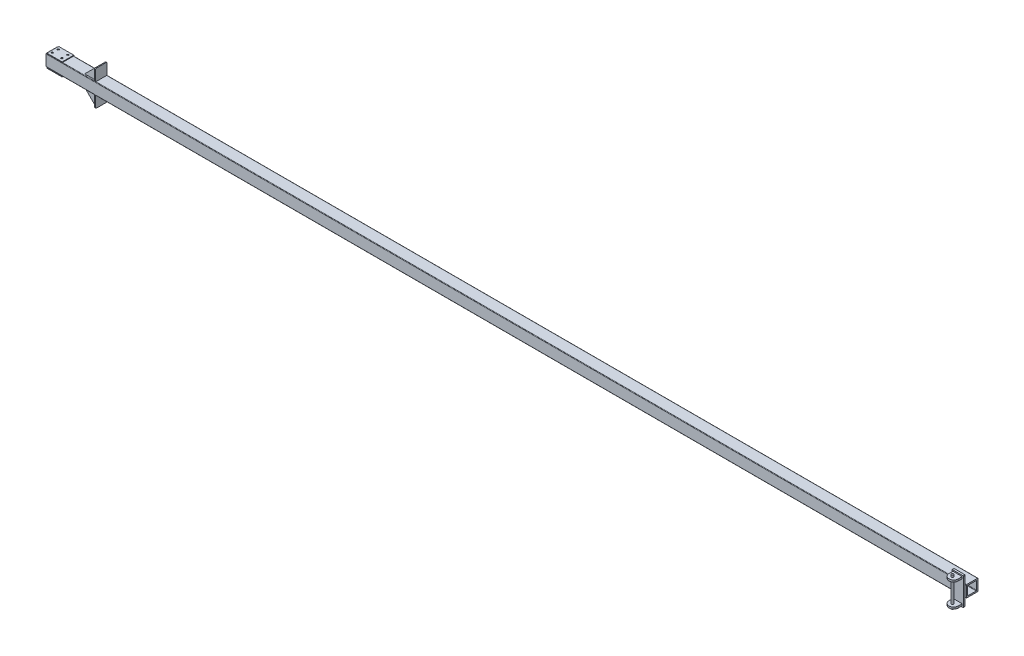
from build123d import *

# Parameters (mm, degrees)
BOSS_EXTRUDE2_START         = -23.4
BOSS_EXTRUDE2_OUTLINE_W     = 4000
BOSS_EXTRUDE2_OUTLINE_H     = 5.9182
BOSS_EXTRUDE2_DEPTH         = 46.8
BOSS_EXTRUDE2_START_2       = -25.4
BOSS_EXTRUDE2_2_OUTLINE_W   = 50
BOSS_EXTRUDE2_2_OUTLINE_H   = 8
BOSS_EXTRUDE2_2_OUTLINE_W_2 = 4000
BOSS_EXTRUDE2_2_OUTLINE_H_2 = 38.9636
BOSS_EXTRUDE2_2_DEPTH       = 5.9182
BOSS_EXTRUDE2_START_3       = 19.4818
BOSS_EXTRUDE2_3_OUTLINE_W   = 50
BOSS_EXTRUDE2_3_OUTLINE_H   = 8
BOSS_EXTRUDE2_3_OUTLINE_W_2 = 4000
BOSS_EXTRUDE2_3_OUTLINE_H_2 = 38.9636
BOSS_EXTRUDE2_3_DEPTH       = 5.9182
BOSS_EXTRUDE2_START_4       = -60
BOSS_EXTRUDE2_4_OUTLINE_W   = 50
BOSS_EXTRUDE2_4_OUTLINE_H   = 8
BOSS_EXTRUDE2_4_DEPTH       = 120
BOSS_EXTRUDE2_START_5       = -28.4
BOSS_EXTRUDE2_5_OUTLINE_W   = 65
BOSS_EXTRUDE2_5_OUTLINE_H   = 50.8
BOSS_EXTRUDE2_5_OUTLINE_R   = 4
BOSS_EXTRUDE2_5_DEPTH       = 3
BOSS_EXTRUDE2_START_6       = 25.4
BOSS_EXTRUDE2_6_OUTLINE_W   = 65
BOSS_EXTRUDE2_6_OUTLINE_H   = 50.8
BOSS_EXTRUDE2_6_OUTLINE_R   = 4
BOSS_EXTRUDE2_6_DEPTH       = 3
BOSS_EXTRUDE2_START_7       = -4000
BOSS_EXTRUDE2_7_DEPTH       = 4000
SKETCH1_W                   = 40
SKETCH1_H                   = 8
BOSS_EXTRUDE1_DEPTH         = 45
FILLET1_R                   = 20
FILLET2_R                   = 2
BOSS_EXTRUDE3_DEPTH         = 10
BOSS_EXTRUDE3_DEPTH_BACK    = 120
SKETCH3_R                   = 4
SKETCH4_W                   = 4
SKETCH4_H                   = 150.8
BOSS_EXTRUDE4_DEPTH         = 50.8
SKETCH5_W                   = 5
SKETCH5_H                   = 50
BOSS_EXTRUDE5_DEPTH         = 50
CUT_EXTRUDE4_DEPTH          = 4002.695965463
FILLET3_R                   = 5
FILLET4_R                   = 5
FILLET5_R                   = 5
FILLET6_R                   = 5


with BuildPart() as part:
    # Boss-Extrude2: read off the stored shape, not the designer's step
    # Boss-Extrude2 outline → Boss-Extrude2 (new body)
    with BuildSketch(Plane(origin=(0, 0, 0), x_dir=(1, 0, 0), z_dir=(0, 1, 0)).offset(BOSS_EXTRUDE2_START)):
        Polygon((-55, -25.4), (-55, -33.4), (-5, -33.4), (-5, -25.4), (0, -25.4), (0, -19.4818), (-4000, -19.4818), (-4000, -25.4), align=None)
        with Locations((-2000, 22.4409)):
            Rectangle(BOSS_EXTRUDE2_OUTLINE_W, BOSS_EXTRUDE2_OUTLINE_H)
    extrude(amount=BOSS_EXTRUDE2_DEPTH)

    # Boss-Extrude2 2 outline → Boss-Extrude2 2 (add)
    with BuildSketch(Plane(origin=(0, 0, 0), x_dir=(1, 0, 0), z_dir=(0, 1, 0)).offset(BOSS_EXTRUDE2_START_2)):
        with Locations((-30, -29.4)):
            Rectangle(BOSS_EXTRUDE2_2_OUTLINE_W, BOSS_EXTRUDE2_2_OUTLINE_H)
        with Locations((-2000, 0)):
            Rectangle(BOSS_EXTRUDE2_2_OUTLINE_W_2, BOSS_EXTRUDE2_2_OUTLINE_H_2)
    extrude(amount=BOSS_EXTRUDE2_2_DEPTH)

    # Boss-Extrude2 3 outline → Boss-Extrude2 3 (add)
    with BuildSketch(Plane(origin=(0, 0, 0), x_dir=(1, 0, 0), z_dir=(0, 1, 0)).offset(BOSS_EXTRUDE2_START_3)):
        with Locations((-30, -29.4)):
            Rectangle(BOSS_EXTRUDE2_3_OUTLINE_W, BOSS_EXTRUDE2_3_OUTLINE_H)
        with Locations((-2000, 0)):
            Rectangle(BOSS_EXTRUDE2_3_OUTLINE_W_2, BOSS_EXTRUDE2_3_OUTLINE_H_2)
    extrude(amount=BOSS_EXTRUDE2_3_DEPTH)

    # Boss-Extrude2 4 outline → Boss-Extrude2 4 (add)
    with BuildSketch(Plane(origin=(0, 0, 0), x_dir=(1, 0, 0), z_dir=(0, 1, 0)).offset(BOSS_EXTRUDE2_START_4)):
        with Locations((-30, -29.4)):
            Rectangle(BOSS_EXTRUDE2_4_OUTLINE_W, BOSS_EXTRUDE2_4_OUTLINE_H)
    extrude(amount=BOSS_EXTRUDE2_4_DEPTH)

    # Boss-Extrude2 5 outline → Boss-Extrude2 5 (add)
    with BuildSketch(Plane(origin=(0, 0, 0), x_dir=(1, 0, 0), z_dir=(0, 1, 0)).offset(BOSS_EXTRUDE2_START_5)):
        with Locations((-3962.5, 0)):
            Rectangle(BOSS_EXTRUDE2_5_OUTLINE_W, BOSS_EXTRUDE2_5_OUTLINE_H)
        with Locations((-3944, 12.4)):
            Circle(BOSS_EXTRUDE2_5_OUTLINE_R, mode=Mode.SUBTRACT)
        with Locations((-3985, -12.4)):
            Circle(BOSS_EXTRUDE2_5_OUTLINE_R, mode=Mode.SUBTRACT)
        with Locations((-3944, -12.4)):
            Circle(BOSS_EXTRUDE2_5_OUTLINE_R, mode=Mode.SUBTRACT)
        with Locations((-3985, 12.4)):
            Circle(BOSS_EXTRUDE2_5_OUTLINE_R, mode=Mode.SUBTRACT)
    extrude(amount=BOSS_EXTRUDE2_5_DEPTH)

    # Boss-Extrude2 6 outline → Boss-Extrude2 6 (add)
    with BuildSketch(Plane(origin=(0, 0, 0), x_dir=(1, 0, 0), z_dir=(0, 1, 0)).offset(BOSS_EXTRUDE2_START_6)):
        with Locations((-3962.5, 0)):
            Rectangle(BOSS_EXTRUDE2_6_OUTLINE_W, BOSS_EXTRUDE2_6_OUTLINE_H)
        with Locations((-3944, 12.4)):
            Circle(BOSS_EXTRUDE2_6_OUTLINE_R, mode=Mode.SUBTRACT)
        with Locations((-3985, -12.4)):
            Circle(BOSS_EXTRUDE2_6_OUTLINE_R, mode=Mode.SUBTRACT)
        with Locations((-3944, -12.4)):
            Circle(BOSS_EXTRUDE2_6_OUTLINE_R, mode=Mode.SUBTRACT)
        with Locations((-3985, 12.4)):
            Circle(BOSS_EXTRUDE2_6_OUTLINE_R, mode=Mode.SUBTRACT)
    extrude(amount=BOSS_EXTRUDE2_6_DEPTH)

    # Boss-Extrude2 7 outline → Boss-Extrude2 7 (add)
    with BuildSketch(Plane.YZ.offset(BOSS_EXTRUDE2_START_7)):
        with BuildLine():
            Line((23.4, 19.4818), (25.4, 19.4818))
            Line((25.4, 19.4818), (25.4, 23.4))
            ThreePointArc((25.4, 23.4), (24.814213562, 24.814213562), (23.4, 25.4))
            Line((23.4, 25.4), (23.4, 19.4818))
        make_face()
        with BuildLine():
            ThreePointArc((23.4, -25.4), (24.814213562, -24.814213562), (25.4, -23.4))
            Line((25.4, -23.4), (25.4, -19.4818))
            Line((25.4, -19.4818), (23.4, -19.4818))
            Line((23.4, -19.4818), (23.4, -25.4))
        make_face()
        with BuildLine():
            Line((19.4818, 19.4818), (17.4818, 19.4818))
            ThreePointArc((17.4818, 19.4818), (18.896013562, 18.896013562), (19.4818, 17.4818))
            Line((19.4818, 17.4818), (19.4818, 19.4818))
        make_face()
        with BuildLine():
            ThreePointArc((-19.4818, 17.4818), (-18.896013562, 18.896013562), (-17.4818, 19.4818))
            Line((-17.4818, 19.4818), (-19.4818, 19.4818))
            Line((-19.4818, 19.4818), (-19.4818, 17.4818))
        make_face()
        with BuildLine():
            Line((19.4818, -19.4818), (19.4818, -17.4818))
            ThreePointArc((19.4818, -17.4818), (18.896013562, -18.896013562), (17.4818, -19.4818))
            Line((17.4818, -19.4818), (19.4818, -19.4818))
        make_face()
        with BuildLine():
            ThreePointArc((-17.4818, -19.4818), (-18.896013562, -18.896013562), (-19.4818, -17.4818))
            Line((-19.4818, -17.4818), (-19.4818, -19.4818))
            Line((-19.4818, -19.4818), (-17.4818, -19.4818))
        make_face()
        with BuildLine():
            Line((-25.4, 23.4), (-25.4, 19.4818))
            Line((-25.4, 19.4818), (-23.4, 19.4818))
            Line((-23.4, 19.4818), (-23.4, 25.4))
            ThreePointArc((-23.4, 25.4), (-24.814213562, 24.814213562), (-25.4, 23.4))
        make_face()
        with BuildLine():
            ThreePointArc((-25.4, -23.4), (-24.814213562, -24.814213562), (-23.4, -25.4))
            Line((-23.4, -25.4), (-23.4, -19.4818))
            Line((-23.4, -19.4818), (-25.4, -19.4818))
            Line((-25.4, -19.4818), (-25.4, -23.4))
        make_face()
    extrude(amount=BOSS_EXTRUDE2_7_DEPTH)

    # Sketch1 → Boss-Extrude1 (add)
    with BuildSketch(Plane.XY.offset(25.4)):
        with Locations((-30, 51)):
            Rectangle(SKETCH1_W, SKETCH1_H)
        with Locations((-30, -51)):
            Rectangle(SKETCH1_W, SKETCH1_H)
    extrude(amount=BOSS_EXTRUDE1_DEPTH)

    # Fillet1
    fillet1_edges = [part.edges().sort_by_distance(p)[0] for p in [
        (-10, 51, 70.4),
        (-50, 51, 70.4),
        (-50, -51, 70.4),
        (-10, -51, 70.4),
    ]]
    fillet(fillet1_edges, radius=FILLET1_R - 0.0001)  # a hair under: the kernel refuses the full size

    # Fillet2
    fillet2_edges = [part.edges().sort_by_distance(p)[0] for p in [
        (-5, -60, 29.4),
        (-5, 60, 29.4),
        (-55, 60, 29.4),
        (-55, -60, 29.4),
    ]]
    fillet(fillet2_edges, radius=FILLET2_R)

    # Sketch3 → Boss-Extrude3 (add, two sides: drawn at the far end of the back side and taken through both)
    with BuildSketch(Plane.XZ.offset(55).offset(-BOSS_EXTRUDE3_DEPTH_BACK)):
        with Locations((-30, 55.4)):
            Circle(SKETCH3_R)
    extrude(amount=BOSS_EXTRUDE3_DEPTH + BOSS_EXTRUDE3_DEPTH_BACK)

    # Sketch4 → Boss-Extrude4 (add)
    with BuildSketch(Plane.XY.offset(25.4)):
        with Locations((-3786.973621807, 0)):
            Rectangle(SKETCH4_W, SKETCH4_H)
    extrude(amount=-BOSS_EXTRUDE4_DEPTH)

    # Sketch5 → Boss-Extrude5 (add)
    with BuildSketch(Plane.ZY.offset(3788.973621807)):
        with Locations((15.9, 50.4)):
            Rectangle(SKETCH5_W, SKETCH5_H)
        with Locations((15.9, -50.4)):
            Rectangle(SKETCH5_W, SKETCH5_H)
        with Locations((-15.9, -50.4)):
            Rectangle(SKETCH5_W, SKETCH5_H)
        with Locations((-15.9, 50.4)):
            Rectangle(SKETCH5_W, SKETCH5_H)
    extrude(amount=BOSS_EXTRUDE5_DEPTH)

    # Sketch6 → Cut-Extrude4 (cut, through all)
    with BuildSketch(Plane(origin=(0, 0, -18.4), x_dir=(-1, 0, 0), z_dir=(0, 0, -1))):
        Polygon((3788.973621807, 75.4), (3838.973621807, 25.4), (3838.973621807, 75.4), align=None)
        Polygon((3788.973621807, -75.4), (3838.973621807, -25.4), (3838.973621807, -75.4), align=None)
    extrude(amount=-CUT_EXTRUDE4_DEPTH, mode=Mode.SUBTRACT)

    # Fillet3
    fillet3_edges = [part.edges().sort_by_distance(p)[0] for p in [
        (-3786.973621807, 75.4, -25.4),
    ]]
    fillet(fillet3_edges, radius=FILLET3_R)

    # Fillet4
    fillet4_edges = [part.edges().sort_by_distance(p)[0] for p in [
        (-3786.973621807, 75.4, 25.4),
    ]]
    fillet(fillet4_edges, radius=FILLET4_R)

    # Fillet5
    fillet5_edges = [part.edges().sort_by_distance(p)[0] for p in [
        (-3786.973621807, -75.4, 25.4),
    ]]
    fillet(fillet5_edges, radius=FILLET5_R)

    # Fillet6
    fillet6_edges = [part.edges().sort_by_distance(p)[0] for p in [
        (-3786.973621807, -75.4, -25.4),
    ]]
    fillet(fillet6_edges, radius=FILLET6_R)


solid = part.part
